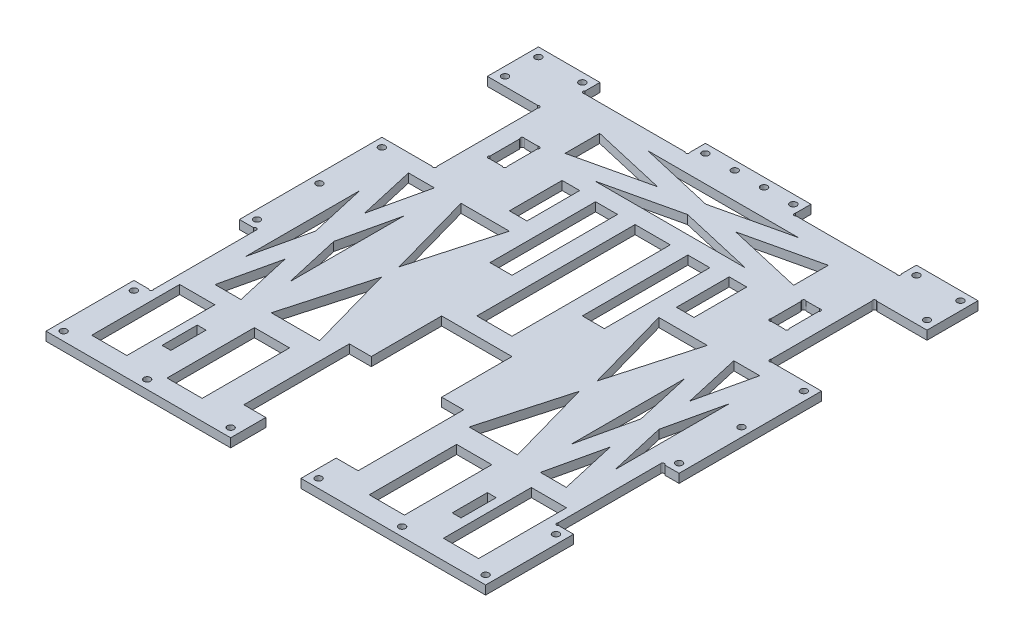
from build123d import *

# Parameters (mm, degrees)
SKETCH1_W           = 317.5
SKETCH1_H           = 355.6
BOSS_EXTRUDE1_DEPTH = 6.35
SKETCH2_W           = 50.8
SKETCH2_H           = 152.4
CUT_EXTRUDE1_DEPTH  = 239.442288615
SKETCH3_W           = 25.4
SKETCH3_H           = 76.2
SKETCH3_W_2         = 12.7
SKETCH3_H_2         = 25.4
CUT_EXTRUDE2_DEPTH  = 239.442288615
SKETCH4_W           = 12.7
SKETCH4_H           = 76.2
SKETCH4_W_2         = 76.2
SKETCH4_H_2         = 12.7
SKETCH4_W_3         = 15.875
CUT_EXTRUDE3_DEPTH  = 239.442288615
SKETCH5_W           = 25.4
SKETCH5_H           = 63.089423232
SKETCH5_H_2         = 114.3
SKETCH5_W_2         = 12.7
SKETCH5_H_3         = 38.1
SKETCH5_H_4         = 63.5
SKETCH5_W_3         = 6.35
SKETCH5_H_5         = 25.4
CUT_EXTRUDE4_DEPTH  = 239.442288615
SKETCH7_R           = 2.413
CUT_EXTRUDE6_DEPTH  = 239.442288615
SKETCH8_R           = 1.27
CUT_EXTRUDE7_DEPTH  = 239.442288615


with BuildPart() as part:
    # Sketch1 → Boss-Extrude1 (new body)
    with BuildSketch(Plane(origin=(0, 0, 0), x_dir=(1, 0, 0), z_dir=(0, 1, 0))):
        Rectangle(SKETCH1_W, SKETCH1_H)
    extrude(amount=BOSS_EXTRUDE1_DEPTH)

    # Sketch2 → Cut-Extrude1 (cut, through all)
    with BuildSketch(Plane(origin=(0, 6.35, 0), x_dir=(1, 0, 0), z_dir=(0, 1, 0))):
        with Locations((0, -101.6)):
            Rectangle(SKETCH2_W, SKETCH2_H)
    extrude(amount=-CUT_EXTRUDE1_DEPTH, mode=Mode.SUBTRACT)

    # Sketch3 → Cut-Extrude2 (cut, through all)
    with BuildSketch(Plane(origin=(0, 6.35, 0), x_dir=(1, 0, 0), z_dir=(0, 1, 0))):
        with Locations((133.35, 102.87)):
            Rectangle(SKETCH3_W, SKETCH3_H)
        with Locations((101.6, 102.87)):
            Rectangle(SKETCH3_W_2, SKETCH3_H_2)
        with Locations((-101.6, 102.87)):
            Rectangle(SKETCH3_W_2, SKETCH3_H_2)
        with Locations((-133.35, 102.87)):
            Rectangle(SKETCH3_W, SKETCH3_H)
    extrude(amount=-CUT_EXTRUDE2_DEPTH, mode=Mode.SUBTRACT)

    # Sketch4 → Cut-Extrude3 (cut, through all)
    with BuildSketch(Plane(origin=(0, 6.35, 0), x_dir=(1, 0, 0), z_dir=(0, 1, 0))):
        with Locations((-152.4, 102.87)):
            Rectangle(SKETCH4_W, SKETCH4_H)
        with Locations((-152.4, -76.2)):
            Rectangle(SKETCH4_W, SKETCH4_H)
        with Locations((152.4, 102.87)):
            Rectangle(SKETCH4_W, SKETCH4_H)
        with Locations((152.4, -76.2)):
            Rectangle(SKETCH4_W, SKETCH4_H)
        with Locations((76.2, 171.45)):
            Rectangle(SKETCH4_W_2, SKETCH4_H_2)
        with Locations((-76.2, 171.45)):
            Rectangle(SKETCH4_W_2, SKETCH4_H_2)
        with Locations((-33.3375, -114.3)):
            Rectangle(SKETCH4_W_3, SKETCH4_H)
        with Locations((33.3375, 63.5)):
            Rectangle(SKETCH4_W_3, SKETCH4_H)
        with Locations((-33.3375, 63.5)):
            Rectangle(SKETCH4_W_3, SKETCH4_H)
        with Locations((33.3375, -114.3)):
            Rectangle(SKETCH4_W_3, SKETCH4_H)
    extrude(amount=-CUT_EXTRUDE3_DEPTH, mode=Mode.SUBTRACT)

    # Sketch5 → Cut-Extrude4 (cut, through all)
    with BuildSketch(Plane(origin=(0, 6.35, 0), x_dir=(1, 0, 0), z_dir=(0, 1, 0))):
        with Locations((-73.025, -131.874711616)):
            Rectangle(SKETCH5_W, SKETCH5_H)
        Polygon((-117.475, -46.432505999), (-126.838066818, -87.63), (-108.111933182, -87.63), align=None)
        Polygon((-133.35, 23.417494001), (-133.35, -58.977494001), (-123.986933182, -17.78), align=None)
        Polygon((-101.6, 23.417494001), (-110.963066818, -17.78), (-101.6, -58.977494001), align=None)
        Polygon((-126.838066818, 52.07), (-117.475, 10.872505999), (-108.111933182, 52.07), align=None)
        Polygon((0, 126.833110246), (-54.310144398, 114.3), (54.310144398, 114.3), align=None)
        Polygon((-82.55, 145.883110246), (-82.55, 120.816889754), (-28.239855602, 133.35), align=None)
        Polygon((82.55, 145.883110246), (28.239855602, 133.35), (82.55, 120.816889754), align=None)
        Polygon((-54.310144398, 152.4), (0, 139.866889754), (54.310144398, 152.4), align=None)
        with Locations((0, 44.45)):
            Rectangle(SKETCH5_W, SKETCH5_H_2)
        with Locations((-60.325, 83.82)):
            Rectangle(SKETCH5_W_2, SKETCH5_H_3)
        with Locations((60.325, 83.82)):
            Rectangle(SKETCH5_W_2, SKETCH5_H_3)
        with Locations((-127, -132.08)):
            Rectangle(SKETCH5_W, SKETCH5_H_4)
        Polygon((-71.4375, -22.791352996), (-88.9, -84.952705992), (-53.975, -84.952705992), align=None)
        with Locations((-104.775, -132.08)):
            Rectangle(SKETCH5_W_3, SKETCH5_H_5)
        Polygon((-53.975, 52.07), (-88.9, 52.07), (-71.4375, -10.091352996), align=None)
    cut_extrude4 = extrude(amount=-CUT_EXTRUDE4_DEPTH, mode=Mode.SUBTRACT)

    # Mirror1: Cut-Extrude4 across plane
    add(cut_extrude4.mirror(Plane(origin=(0, 0, 0), x_dir=(0, 0, 1), z_dir=(1, 0, 0))), mode=Mode.SUBTRACT)

    # Sketch7 → Cut-Extrude6 (cut, through all)
    with BuildSketch(Plane(origin=(0, 6.35, 0), x_dir=(1, 0, 0), z_dir=(0, 1, 0))):
        with Locations((-152.4, -171.45)):
            Circle(SKETCH7_R)
        with Locations((-152.4, 171.45)):
            Circle(SKETCH7_R)
        with Locations((-120.65, 171.45)):
            Circle(SKETCH7_R)
        with Locations((-152.4, 147.32)):
            Circle(SKETCH7_R)
        with Locations((-31.75, 171.45)):
            Circle(SKETCH7_R)
        with Locations((-10.583333333, 171.45)):
            Circle(SKETCH7_R)
        with Locations((10.583333333, 171.45)):
            Circle(SKETCH7_R)
        with Locations((31.75, 171.45)):
            Circle(SKETCH7_R)
        with Locations((-31.75, -171.45)):
            Circle(SKETCH7_R)
        with Locations((-92.075, -171.45)):
            Circle(SKETCH7_R)
        with Locations((-152.4, -120.65)):
            Circle(SKETCH7_R)
        with Locations((-152.4, -31.75)):
            Circle(SKETCH7_R)
        with Locations((-152.4, 58.42)):
            Circle(SKETCH7_R)
        with Locations((-152.4, 13.335)):
            Circle(SKETCH7_R)
        with Locations((31.75, -171.45)):
            Circle(SKETCH7_R)
        with Locations((152.4, 13.335)):
            Circle(SKETCH7_R)
        with Locations((152.4, 58.42)):
            Circle(SKETCH7_R)
        with Locations((152.4, -31.75)):
            Circle(SKETCH7_R)
        with Locations((152.4, -120.65)):
            Circle(SKETCH7_R)
        with Locations((92.075, -171.45)):
            Circle(SKETCH7_R)
        with Locations((152.4, 147.32)):
            Circle(SKETCH7_R)
        with Locations((120.65, 171.45)):
            Circle(SKETCH7_R)
        with Locations((152.4, 171.45)):
            Circle(SKETCH7_R)
        with Locations((152.4, -171.45)):
            Circle(SKETCH7_R)
    extrude(amount=-CUT_EXTRUDE6_DEPTH, mode=Mode.SUBTRACT)

    # Sketch8 → Cut-Extrude7 (cut, through all)
    with BuildSketch(Plane(origin=(0, 6.35, 0), x_dir=(1, 0, 0), z_dir=(0, 1, 0))):
        with Locations((-39.09938383, 165.88366572)):
            Circle(SKETCH8_R)
        with Locations((-113.539841326, 166.117378391)):
            Circle(SKETCH8_R)
        with Locations((-121.560019166, 140.084130304)):
            Circle(SKETCH8_R)
        with Locations((-121.565556473, 65.650145639)):
            Circle(SKETCH8_R)
        with Locations((-147.253032713, -38.506954901)):
            Circle(SKETCH8_R)
        with Locations((-147.044413998, -113.510037468)):
            Circle(SKETCH8_R)
        with Locations((-107.194291917, 114.549311364)):
            Circle(SKETCH8_R)
        with Locations((-96.034081321, 114.570942203)):
            Circle(SKETCH8_R)
        with Locations((-107.184450657, 91.18332828)):
            Circle(SKETCH8_R)
        with Locations((-96.208355861, 91.003339093)):
            Circle(SKETCH8_R)
    cut_extrude7 = extrude(amount=-CUT_EXTRUDE7_DEPTH, mode=Mode.SUBTRACT)

    # Mirror2: Cut-Extrude7 across plane
    add(cut_extrude7.mirror(Plane(origin=(0, 0, 0), x_dir=(0, 0, 1), z_dir=(1, 0, 0))), mode=Mode.SUBTRACT)


solid = part.part
